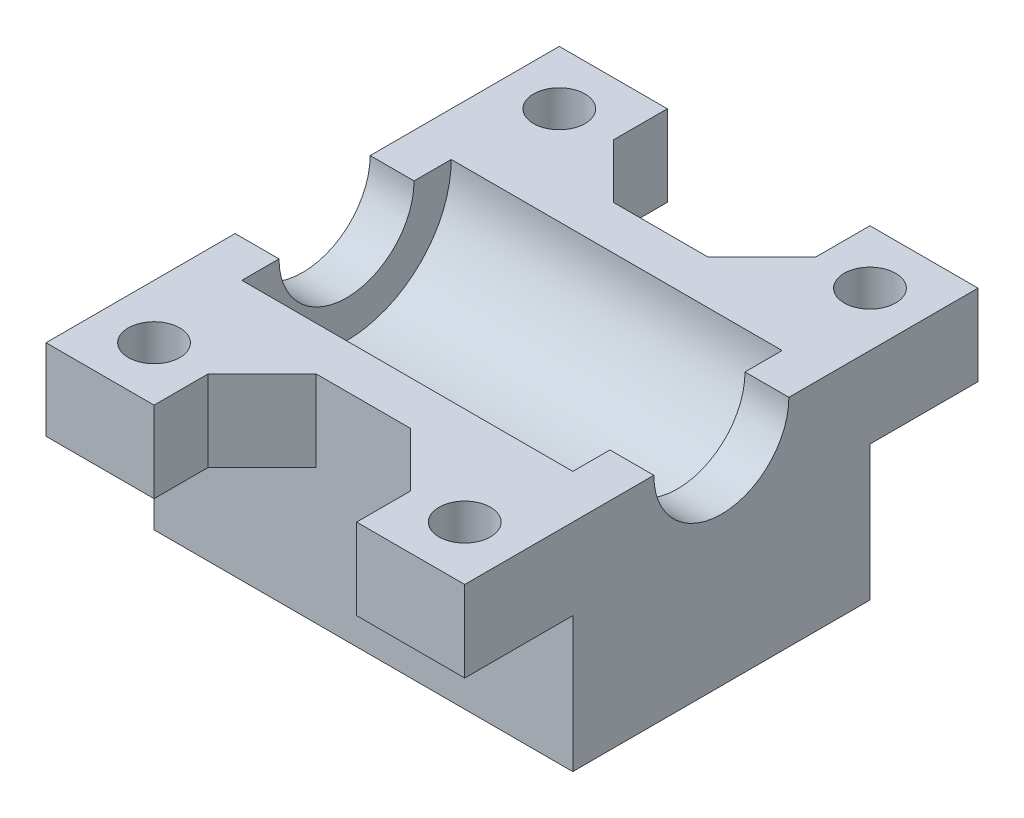
from build123d import *

# Parameters (mm, degrees)
SKETCH1_W                 = 31
SKETCH1_H                 = 22
BOSS_EXTRUDE1_DEPTH       = 11
SKETCH2_W                 = 31
SKETCH2_H                 = 22
SKETCH2_R                 = 7.843750423
BOSS_EXTRUDE2_DEPTH       = 5
SKETCH3_W                 = 24.5
SKETCH3_H                 = 15.5
CUT_EXTRUDE1_DEPTH        = 7.75
FILLET1_R                 = 7.75
CUT_EXTRUDE2_DEPTH        = 32.812929761
CUT_EXTRUDE2_DEPTH_BACK   = 32.812929761
SKETCH4_R                 = 5
SKETCH5_W                 = 8
SKETCH5_H                 = 8
SKETCH5_R                 = 1.905800151
BOSS_EXTRUDE3_DEPTH       = 6
CUT_EXTRUDE3_START        = -3
SKETCH6_R                 = 3
SKETCH6_R_2               = 1.905800151
CUT_EXTRUDE3_DEPTH        = 3
MIRROR9_COPY_1_SKETCH_W   = 8
MIRROR9_COPY_1_SKETCH_H   = 8
MIRROR9_COPY_1_SKETCH_R   = 1.905800151
MIRROR9_COPY_1_DEPTH      = 6
MIRROR9_START             = -3
MIRROR9_COPY_2_SKETCH_R   = 3
MIRROR9_COPY_2_SKETCH_R_2 = 1.905800151
MIRROR9_COPY_2_DEPTH      = 3
CHAMFER2_SIZE             = 4


with BuildPart() as part:
    # Sketch1 → Boss-Extrude1 (new body)
    with BuildSketch(Plane(origin=(0, 0, 0), x_dir=(1, 0, 0), z_dir=(0, 1, 0))):
        Rectangle(SKETCH1_W, SKETCH1_H)
    extrude(amount=BOSS_EXTRUDE1_DEPTH)

    # Sketch2 → Boss-Extrude2 (add)
    with BuildSketch(Plane(origin=(0, 0, 0), x_dir=(1, 0, 0), z_dir=(0, 1, 0))):
        Rectangle(SKETCH2_W, SKETCH2_H)
        with Locations(Location((0, 0, 0), (0, 0, 270))):
            Circle(SKETCH2_R, mode=Mode.SUBTRACT)
    extrude(amount=-BOSS_EXTRUDE2_DEPTH)

    # Sketch3 → Cut-Extrude1 (cut)
    with BuildSketch(Plane(origin=(0, 11, 0), x_dir=(1, 0, 0), z_dir=(0, 1, 0))):
        Rectangle(SKETCH3_W, SKETCH3_H)
    extrude(amount=-CUT_EXTRUDE1_DEPTH, mode=Mode.SUBTRACT)

    # Fillet1
    fillet1_edges = [part.edges().sort_by_distance(p)[0] for p in [
        (0, 3.25, 7.75),
        (0, 3.25, -7.75),
    ]]
    fillet(fillet1_edges, radius=FILLET1_R - 0.0001)  # a hair under: the kernel refuses the full size

    # Sketch4 → Cut-Extrude2 (cut, two sides: drawn at the far end of the back side and taken through both)
    with BuildSketch(Plane(origin=(-12.25, 0, 0), x_dir=(0, 0, -1), z_dir=(1, 0, 0)).offset(-CUT_EXTRUDE2_DEPTH_BACK)):
        with Locations((0, 11)):
            Circle(SKETCH4_R)
    extrude(amount=CUT_EXTRUDE2_DEPTH + CUT_EXTRUDE2_DEPTH_BACK, mode=Mode.SUBTRACT)

    # Sketch5 → Boss-Extrude3 (add)
    with BuildSketch(Plane(origin=(0, 11, 0), x_dir=(1, 0, 0), z_dir=(0, 1, 0))):
        with Locations((11.5, -15)):
            Rectangle(SKETCH5_W, SKETCH5_H)
        with Locations(Location((11.5, -15, 0), (0, 0, 270))):
            Circle(SKETCH5_R, mode=Mode.SUBTRACT)
    boss_extrude3 = extrude(amount=-BOSS_EXTRUDE3_DEPTH)

    # Sketch6 → Cut-Extrude3 (cut)
    with BuildSketch(Plane.XZ.offset(-5).offset(CUT_EXTRUDE3_START)):
        with Locations(Location((11.5, 15, 0), (0, 0, 270))):
            Circle(SKETCH6_R)
        with Locations(Location((11.5, 15, 0), (0, 0, 90))):
            Circle(SKETCH6_R_2, mode=Mode.SUBTRACT)
    cut_extrude3 = extrude(amount=CUT_EXTRUDE3_DEPTH, mode=Mode.SUBTRACT)

    # Mirror8: Boss-Extrude3, Cut-Extrude3 across plane
    add(boss_extrude3.mirror(Plane(origin=(0, 0, 0), x_dir=(0, 0, 1), z_dir=(1, 0, 0))))
    add(cut_extrude3.mirror(Plane(origin=(0, 0, 0), x_dir=(0, 0, 1), z_dir=(1, 0, 0))), mode=Mode.SUBTRACT)

    # Mirror9: Boss-Extrude3, Cut-Extrude3 across plane
    add(boss_extrude3.mirror(Plane.XY))
    add(cut_extrude3.mirror(Plane.XY), mode=Mode.SUBTRACT)

    # Mirror9 copy 1 sketch → Mirror9 copy 1 (add)
    with BuildSketch(Plane(origin=(0, 11, 0), x_dir=(-1, 0, 0), z_dir=(0, 1, 0))):
        with Locations((11.5, -15)):
            Rectangle(MIRROR9_COPY_1_SKETCH_W, MIRROR9_COPY_1_SKETCH_H)
        with Locations(Location((11.5, -15, 0), (0, 0, 270))):
            Circle(MIRROR9_COPY_1_SKETCH_R, mode=Mode.SUBTRACT)
    extrude(amount=-MIRROR9_COPY_1_DEPTH)

    # Mirror9 copy 2 sketch → Mirror9 copy 2 (cut)
    with BuildSketch(Plane(origin=(0, 5, 0), x_dir=(-1, 0, 0), z_dir=(0, -1, 0)).offset(MIRROR9_START)):
        with Locations(Location((11.5, 15, 0), (0, 0, 270))):
            Circle(MIRROR9_COPY_2_SKETCH_R)
        with Locations(Location((11.5, 15, 0), (0, 0, 90))):
            Circle(MIRROR9_COPY_2_SKETCH_R_2, mode=Mode.SUBTRACT)
    extrude(amount=MIRROR9_COPY_2_DEPTH, mode=Mode.SUBTRACT)

    # Chamfer2
    chamfer2_edges = [part.edges().sort_by_distance(p)[0] for p in [
        (-7.5, 8, -11),
        (7.5, 8, -11),
        (7.5, 8, 11),
        (-7.5, 8, 11),
    ]]
    chamfer(chamfer2_edges, length=CHAMFER2_SIZE)


solid = part.part
